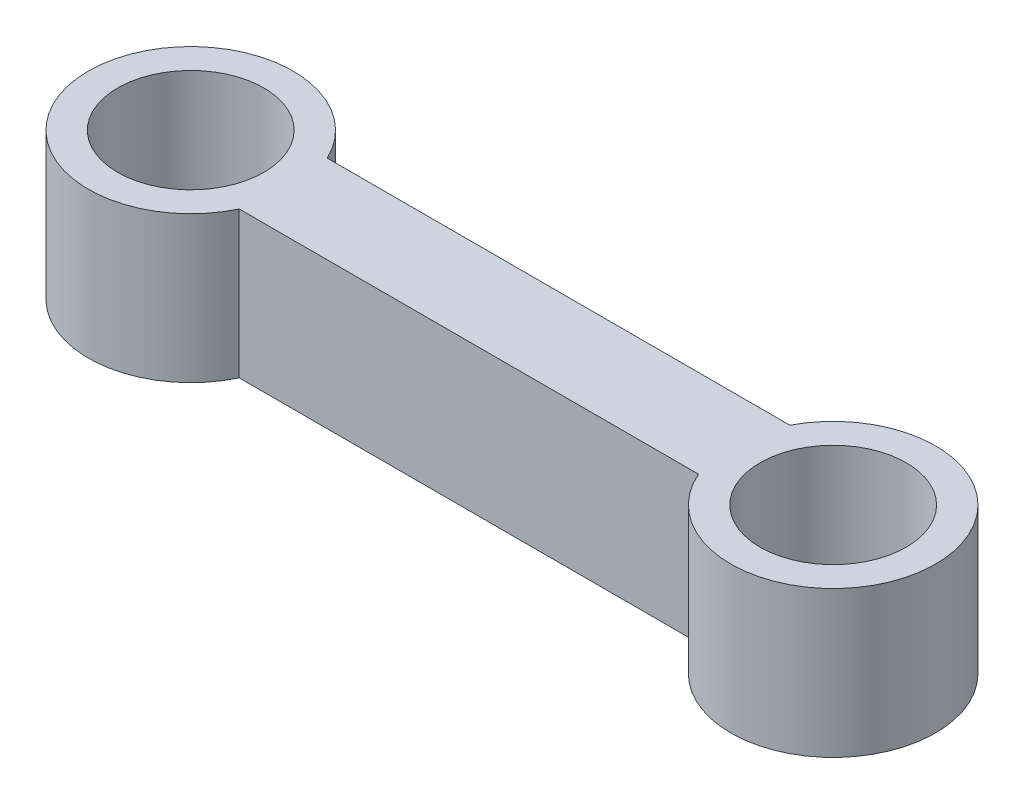
from build123d import *

# Parameters (mm, degrees)
BOSS_EXTRU_2_DEPTH      = 100
ESQUISSE2_R             = 50
ENL_V_MAT_EXTRU_2_DEPTH = 95


with BuildPart() as part:
    # Esquisse1 → Boss.-Extru.2 (new body)
    with BuildSketch(Plane(origin=(0, 0, 0), x_dir=(1, 0, 0), z_dir=(0, 1, 0))):
        with BuildLine():
            Line((379.401849177, 30.095541494), (63.200145428, 30.095541494))
            ThreePointArc((63.200145428, 30.095541494), (-70, 0), (63.200145428, -30.095541494))
            Line((63.200145428, -30.095541494), (377.209706533, -30.095541494))
            ThreePointArc((377.209706533, -30.095541494), (511.408174051, -4.847552565), (379.401849177, 30.095541494))
        make_face()
    extrude(amount=BOSS_EXTRU_2_DEPTH)

    # Esquisse2 → Enlèv. mat.-Extru.2 (cut)
    with BuildSketch(Plane(origin=(0, 100, 0), x_dir=(1, 0, 0), z_dir=(0, 1, 0))):
        Circle(ESQUISSE2_R)
        with Locations((441.45455179, -2.299860933)):
            Circle(ESQUISSE2_R)
    extrude(amount=-ENL_V_MAT_EXTRU_2_DEPTH, mode=Mode.SUBTRACT)


solid = part.part
